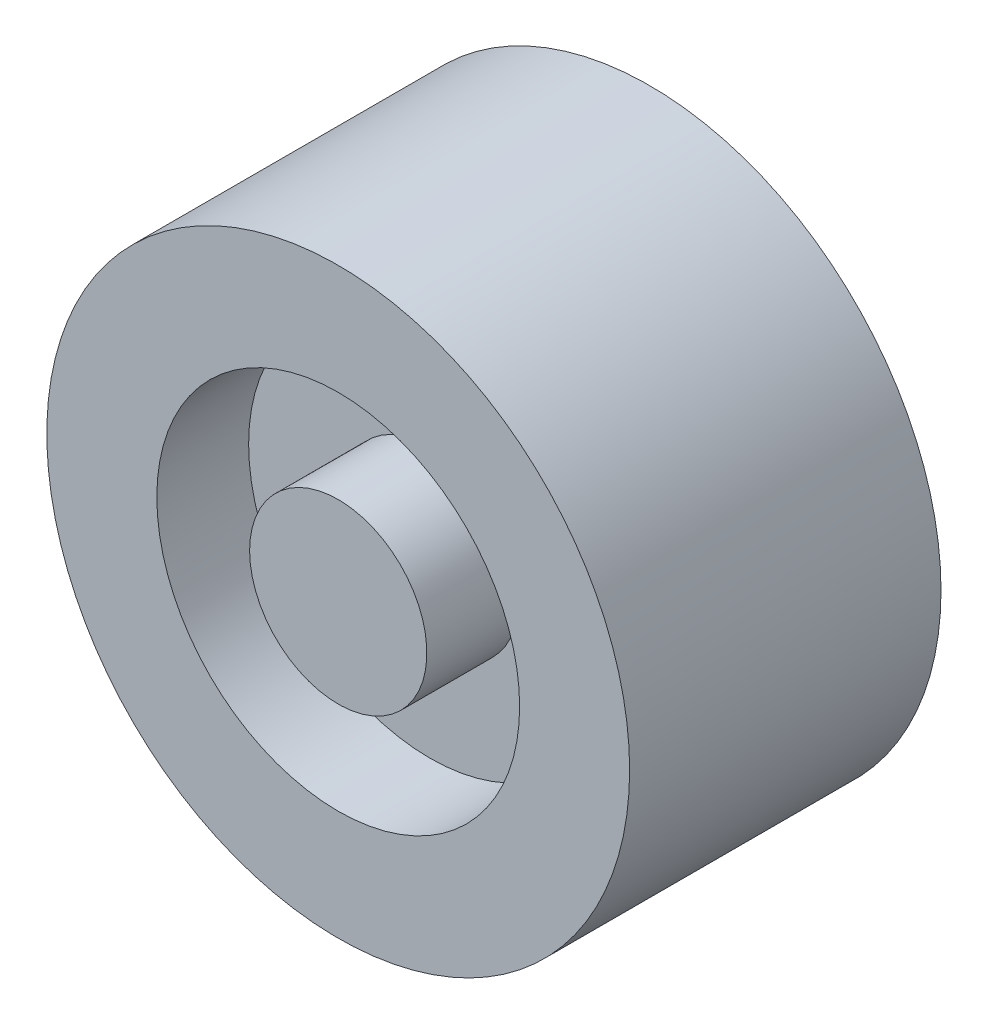
from build123d import *

# Parameters (mm, degrees)
SKETCH1_R           = 15.07617
BOSS_EXTRUDE1_DEPTH = 16.10868
SKETCH2_R           = 9.3853
SKETCH2_R_2         = 4.5847
CUT_EXTRUDE1_DEPTH  = 4.7498


with BuildPart() as part:
    # Sketch1 → Boss-Extrude1 (new body)
    with BuildSketch(Plane.XY):
        Circle(SKETCH1_R)
    extrude(amount=BOSS_EXTRUDE1_DEPTH)

    # Sketch2 → Cut-Extrude1 (cut)
    with BuildSketch(Plane(origin=(0, 0, 0), x_dir=(-1, 0, 0), z_dir=(0, 0, -1))):
        Circle(SKETCH2_R)
        Circle(SKETCH2_R_2, mode=Mode.SUBTRACT)
    cut_extrude1 = extrude(amount=-CUT_EXTRUDE1_DEPTH, mode=Mode.SUBTRACT)

    # Mirror1: Cut-Extrude1 across plane
    add(cut_extrude1.mirror(Plane(origin=(0, 0, 8.05434), x_dir=(1, 0, 0), z_dir=(0, 0, -1))), mode=Mode.SUBTRACT)


solid = part.part
